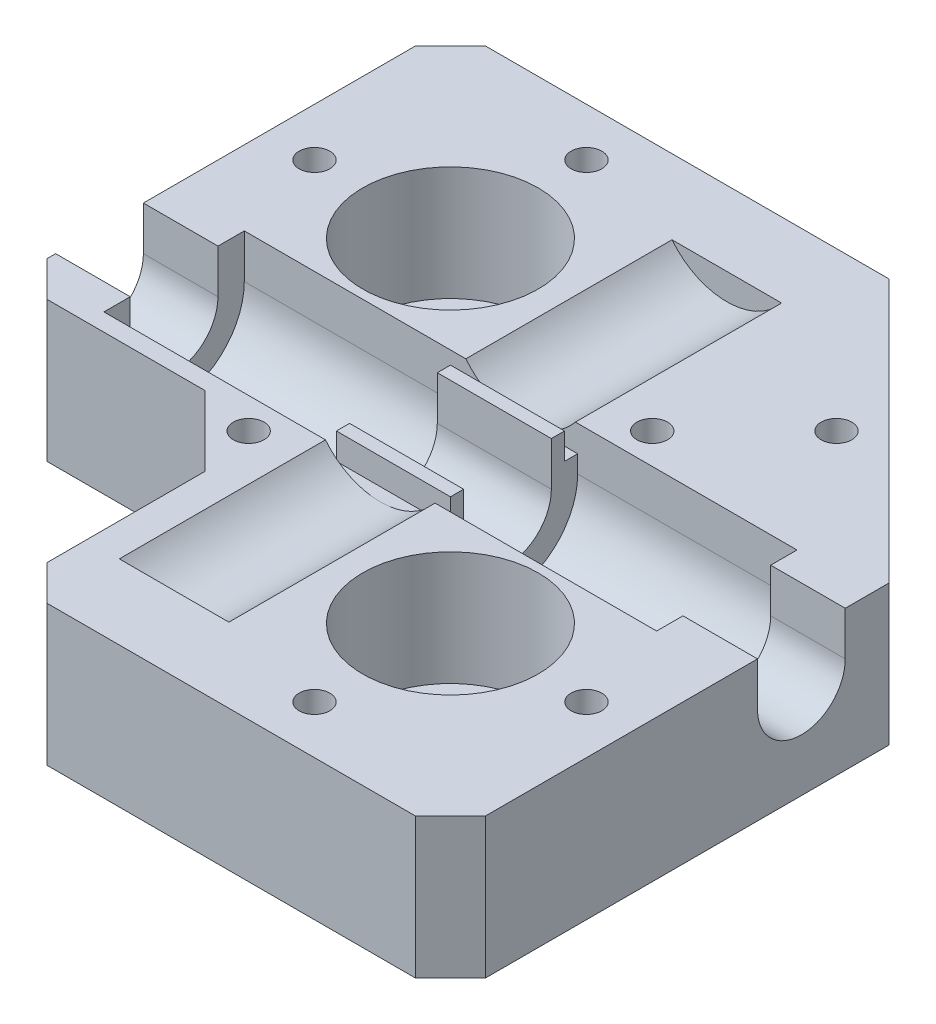
from build123d import *

# Parameters (mm, degrees)
SKETCH1_W               = 80
SKETCH1_H               = 80
BOSS_EXTRUDE1_DEPTH     = 16
CUT_EXTRUDE1_DEPTH      = 59.787753827
CUT_EXTRUDE1_DEPTH_BACK = 59.787753827
SKETCH2_R               = 1.75
SKETCH3_W               = 25
SKETCH3_H               = 16
CUT_EXTRUDE2_DEPTH      = 13
FILLET1_R               = 8
SKETCH4_W               = 16
SKETCH4_H               = 25
CUT_EXTRUDE3_DEPTH      = 3
BOSS_EXTRUDE2_DEPTH     = 23.5
CUT_EXTRUDE4_DEPTH      = 59.787753827
CUT_EXTRUDE4_DEPTH_BACK = 59.787753827
CUT_EXTRUDE5_DEPTH      = 59.787753827
CUT_EXTRUDE5_DEPTH_BACK = 59.787753827
SKETCH7_R               = 10
CUT_EXTRUDE6_DEPTH      = 59.787753827
CUT_EXTRUDE6_DEPTH_BACK = 59.787753827
CHAMFER1_SIZE           = 4
CHAMFER2_SIZE           = 30
BOSS_EXTRUDE4_START     = -3
SKETCH11_R              = 10
SKETCH11_R_2            = 4.25
BOSS_EXTRUDE4_DEPTH     = 3
SKETCH12_R              = 4
CUT_EXTRUDE7_DEPTH      = 5
CUT_EXTRUDE8_START      = -10
SKETCH13_R              = 3
SKETCH13_R_2            = 1.75
CUT_EXTRUDE8_DEPTH      = 10


with BuildPart() as part:
    # Sketch1 → Boss-Extrude1 (new body)
    with BuildSketch(Plane(origin=(0, 0, 0), x_dir=(1, 0, 0), z_dir=(0, 1, 0))):
        Rectangle(SKETCH1_W, SKETCH1_H)
    extrude(amount=-BOSS_EXTRUDE1_DEPTH)

    # Sketch2 → Cut-Extrude1 (cut, two sides: drawn at the far end of the back side and taken through both)
    with BuildSketch(Plane(origin=(0, 0, 0), x_dir=(1, 0, 0), z_dir=(0, 1, 0)).offset(-CUT_EXTRUDE1_DEPTH_BACK)):
        with Locations(Location((-11.5, -11.5, 0), (0, 0, 270))):
            Circle(SKETCH2_R)
        with Locations(Location((11.5, 11.5, 0), (0, 0, 270))):
            Circle(SKETCH2_R)
        with Locations(Location((22, 22, 0), (0, 0, 270))):
            Circle(SKETCH2_R)
        with Locations(Location((19, -34.5, 0), (0, 0, 270))):
            Circle(SKETCH2_R)
        with Locations(Location((34.5, -19, 0), (0, 0, 270))):
            Circle(SKETCH2_R)
        with Locations(Location((-34.5, 19, 0), (0, 0, 270))):
            Circle(SKETCH2_R)
        with Locations(Location((-19, 34.5, 0), (0, 0, 270))):
            Circle(SKETCH2_R)
    extrude(amount=CUT_EXTRUDE1_DEPTH + CUT_EXTRUDE1_DEPTH_BACK, mode=Mode.SUBTRACT)

    # Sketch3 → Cut-Extrude2 (cut)
    with BuildSketch(Plane(origin=(0, 0, 0), x_dir=(1, 0, 0), z_dir=(0, 1, 0))):
        with Locations((19, 0)):
            Rectangle(SKETCH3_W, SKETCH3_H)
        with Locations((-19, 0)):
            Rectangle(SKETCH3_W, SKETCH3_H)
    extrude(amount=-CUT_EXTRUDE2_DEPTH, mode=Mode.SUBTRACT)

    # Fillet1
    fillet1_edges = [part.edges().sort_by_distance(p)[0] for p in [
        (19, -13, 8),
        (19, -13, -8),
        (-19, -13, 8),
        (-19, -13, -8),
    ]]
    fillet(fillet1_edges, radius=FILLET1_R - 0.0001)  # a hair under: the kernel refuses the full size

    # Sketch4 → Cut-Extrude3 (cut)
    with BuildSketch(Plane(origin=(0, 0, 0), x_dir=(1, 0, 0), z_dir=(0, 1, 0))):
        with Locations((0, -19)):
            Rectangle(SKETCH4_W, SKETCH4_H)
        with Locations((0, 19)):
            Rectangle(SKETCH4_W, SKETCH4_H)
    extrude(amount=-CUT_EXTRUDE3_DEPTH, mode=Mode.SUBTRACT)

    # Sketch5 → Boss-Extrude2 (add)
    with BuildSketch(Plane(origin=(0, 0, 31.5), x_dir=(-1, 0, 0), z_dir=(0, 0, -1))):
        with BuildLine():
            ThreePointArc((1.5e-08, -3), (-3.464101608, -2.211102554), (-6.244997998, 0))
            Line((-6.244997998, 0), (-8, 0))
            Line((-8, 0), (-8, -3))
            Line((-8, -3), (1.5e-08, -3))
        make_face()
        with BuildLine():
            Line((8, -3), (8, 0))
            Line((8, 0), (6.244997998, 0))
            ThreePointArc((6.244997998, 0), (3.464101622, -2.211102548), (1.5e-08, -3))
            Line((1.5e-08, -3), (8, -3))
        make_face()
    boss_extrude2 = extrude(amount=BOSS_EXTRUDE2_DEPTH)

    # Mirror1: Boss-Extrude2 across plane
    add(boss_extrude2.mirror(Plane.XY))

    # Sketch6 → Cut-Extrude4 (cut, two sides: drawn at the far end of the back side and taken through both)
    with BuildSketch(Plane(origin=(0, 0, 0), x_dir=(0, 0, -1), z_dir=(1, 0, 0)).offset(-CUT_EXTRUDE4_DEPTH_BACK)):
        with BuildLine():
            ThreePointArc((-5, -5), (0, -10), (5, -5))
            Line((5, -5), (-5, -5))
        make_face()
        with BuildLine():
            Line((-5, -5), (5, -5))
            ThreePointArc((5, -5), (3.535533906, -1.464466094), (0, 0))
            ThreePointArc((0, 0), (-3.535533906, -1.464466094), (-5, -5))
        make_face()
        with BuildLine():
            Line((-5, 0), (-5, -5))
            ThreePointArc((-5, -5), (-3.535533906, -1.464466094), (0, 0))
            Line((0, 0), (-5, 0))
        make_face()
        with BuildLine():
            ThreePointArc((0, 0), (3.535533906, -1.464466094), (5, -5))
            Line((5, -5), (5, 0))
            Line((5, 0), (0, 0))
        make_face()
    extrude(amount=CUT_EXTRUDE4_DEPTH + CUT_EXTRUDE4_DEPTH_BACK, mode=Mode.SUBTRACT)

    # Sketch7 → Cut-Extrude5 (cut, two sides: drawn at the far end of the back side and taken through both)
    with BuildSketch(Plane(origin=(0, 0, 0), x_dir=(1, 0, 0), z_dir=(0, 1, 0)).offset(-CUT_EXTRUDE5_DEPTH_BACK)):
        with Locations(Location((19, -19, 0), (0, 0, 270))):
            Circle(SKETCH7_R)
        with Locations(Location((-19, 19, 0), (0, 0, 270))):
            Circle(SKETCH7_R)
    extrude(amount=CUT_EXTRUDE5_DEPTH + CUT_EXTRUDE5_DEPTH_BACK, mode=Mode.SUBTRACT)

    # Sketch9 → Cut-Extrude6 (cut, two sides: drawn at the far end of the back side and taken through both)
    with BuildSketch(Plane(origin=(0, 0, 0), x_dir=(1, 0, 0), z_dir=(0, 1, 0)).offset(-CUT_EXTRUDE6_DEPTH_BACK)):
        Polygon((-10, -18), (-18, -10), (-18, -18), align=None)
        Polygon((-10, -40), (-10, -18), (-18, -18), (-18, -10), (-40, -10), (-40, -40), align=None)
    extrude(amount=CUT_EXTRUDE6_DEPTH + CUT_EXTRUDE6_DEPTH_BACK, mode=Mode.SUBTRACT)

    # Chamfer1
    chamfer1_edges = [part.edges().sort_by_distance(p)[0] for p in [
        (-10, -8, 40),
        (-40, -8, 10),
        (40, -8, 40),
        (-40, -8, -40),
    ]]
    chamfer(chamfer1_edges, length=CHAMFER1_SIZE)

    # Chamfer2
    chamfer2_edges = [part.edges().sort_by_distance(p)[0] for p in [
        (40, -8, -40),
    ]]
    chamfer(chamfer2_edges, length=CHAMFER2_SIZE)

    # Sketch11 → Boss-Extrude4 (add)
    # profile 1 of 2: a face of its own
    with BuildSketch(Plane.XZ.offset(16).offset(BOSS_EXTRUDE4_START)):
        with Locations(Location((-19, -19, 0), (0, 0, 270))):
            Circle(SKETCH11_R)
        with Locations(Location((-19, -19, 0), (0, 0, 270))):
            Circle(SKETCH11_R_2, mode=Mode.SUBTRACT)
    # profile 2 of 2: a face of its own
    with BuildSketch(Plane.XZ.offset(16).offset(BOSS_EXTRUDE4_START)):
        with Locations(Location((19, 19, 0), (0, 0, 270))):
            Circle(SKETCH11_R)
        with Locations(Location((19, 19, 0), (0, 0, 270))):
            Circle(SKETCH11_R_2, mode=Mode.SUBTRACT)
    extrude(amount=BOSS_EXTRUDE4_DEPTH)

    # Sketch12 → Cut-Extrude7 (cut)
    with BuildSketch(Plane.XZ.offset(16)):
        with Locations(Location((0, 0, 0), (0, 0, 270))):
            Circle(SKETCH12_R)
        with Locations(Location((16.75, -16.75, 0), (0, 0, 270))):
            Circle(SKETCH12_R)
    extrude(amount=-CUT_EXTRUDE7_DEPTH, mode=Mode.SUBTRACT)

    # Sketch13 → Cut-Extrude8 (cut)
    # profile 1 of 7: a face of its own
    with BuildSketch(Plane.XZ.offset(16).offset(CUT_EXTRUDE8_START)):
        with Locations(Location((19, 34.5, 0), (0, 0, 270))):
            Circle(SKETCH13_R)
        with Locations(Location((19, 34.5, 0), (0, 0, 270))):
            Circle(SKETCH13_R_2, mode=Mode.SUBTRACT)
    # profile 2 of 7: a face of its own
    with BuildSketch(Plane.XZ.offset(16).offset(CUT_EXTRUDE8_START)):
        with Locations(Location((34.5, 19, 0), (0, 0, 270))):
            Circle(SKETCH13_R)
        with Locations(Location((34.5, 19, 0), (0, 0, 270))):
            Circle(SKETCH13_R_2, mode=Mode.SUBTRACT)
    # profile 3 of 7: a face of its own
    with BuildSketch(Plane.XZ.offset(16).offset(CUT_EXTRUDE8_START)):
        with Locations(Location((-11.5, 11.5, 0), (0, 0, 270))):
            Circle(SKETCH13_R)
        with Locations(Location((-11.5, 11.5, 0), (0, 0, 270))):
            Circle(SKETCH13_R_2, mode=Mode.SUBTRACT)
    # profile 4 of 7: a face of its own
    with BuildSketch(Plane.XZ.offset(16).offset(CUT_EXTRUDE8_START)):
        with Locations(Location((-34.5, -19, 0), (0, 0, 270))):
            Circle(SKETCH13_R)
        with Locations(Location((-34.5, -19, 0), (0, 0, 270))):
            Circle(SKETCH13_R_2, mode=Mode.SUBTRACT)
    # profile 5 of 7: a face of its own
    with BuildSketch(Plane.XZ.offset(16).offset(CUT_EXTRUDE8_START)):
        with Locations(Location((-19, -34.5, 0), (0, 0, 270))):
            Circle(SKETCH13_R)
        with Locations(Location((-19, -34.5, 0), (0, 0, 270))):
            Circle(SKETCH13_R_2, mode=Mode.SUBTRACT)
    # profile 6 of 7: a face of its own
    with BuildSketch(Plane.XZ.offset(16).offset(CUT_EXTRUDE8_START)):
        with Locations(Location((11.5, -11.5, 0), (0, 0, 270))):
            Circle(SKETCH13_R)
        with Locations(Location((11.5, -11.5, 0), (0, 0, 270))):
            Circle(SKETCH13_R_2, mode=Mode.SUBTRACT)
    # profile 7 of 7: a face of its own
    with BuildSketch(Plane.XZ.offset(16).offset(CUT_EXTRUDE8_START)):
        with Locations(Location((22, -22, 0), (0, 0, 270))):
            Circle(SKETCH13_R)
        with Locations(Location((22, -22, 0), (0, 0, 270))):
            Circle(SKETCH13_R_2, mode=Mode.SUBTRACT)
    extrude(amount=CUT_EXTRUDE8_DEPTH, mode=Mode.SUBTRACT)


solid = part.part
